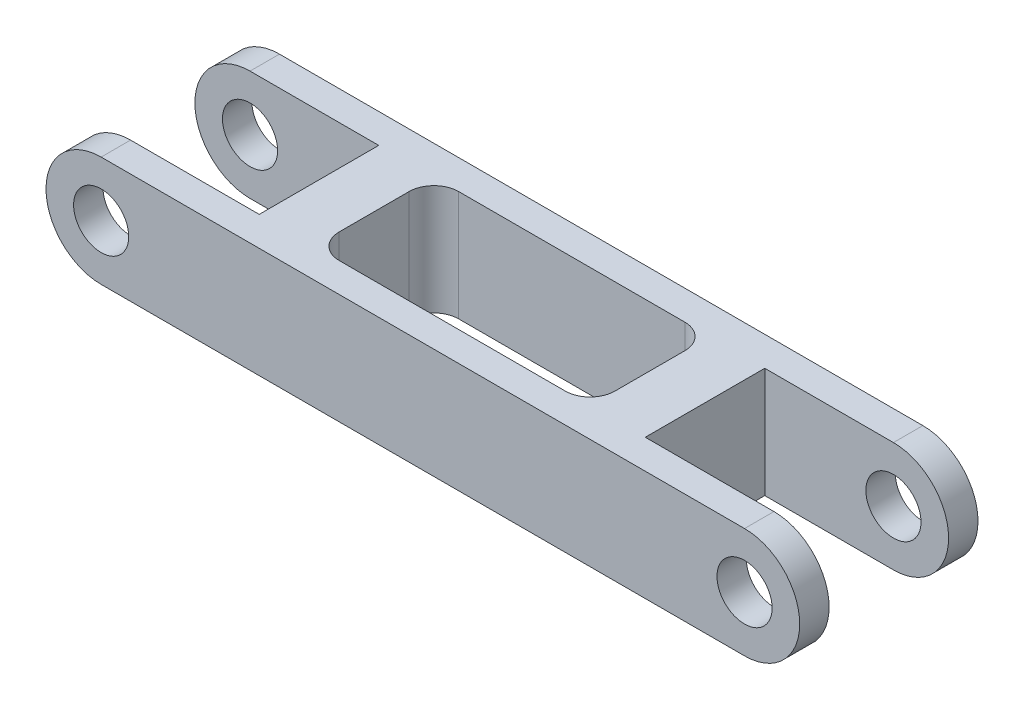
from build123d import *

# Parameters (mm, degrees)
SKETCH_1_R          = 3
EXTRUDE_1_DEPTH     = 19.4
SKETCH_2_W          = 20
SKETCH_2_H          = 13
CUT_EXTRUDE_1_DEPTH = 47.918653007


with BuildPart() as part:
    # 草图1 → 凸台-拉伸1 (new body)
    with BuildSketch(Plane.XY):
        with BuildLine():
            Line((-35, 6), (35, 6))
            ThreePointArc((35, 6), (41, 0), (35, -6))
            Line((35, -6), (-35, -6))
            ThreePointArc((-35, -6), (-41, 0), (-35, 6))
        make_face()
        with Locations((-35, 0)):
            Circle(SKETCH_1_R, mode=Mode.SUBTRACT)
        with Locations((35, 0)):
            Circle(SKETCH_1_R, mode=Mode.SUBTRACT)
    extrude(amount=EXTRUDE_1_DEPTH)

    # 草图2 → 切除-拉伸1 (cut, through all)
    with BuildSketch(Plane(origin=(0, 6, 0), x_dir=(1, 0, 0), z_dir=(0, 1, 0))):
        with Locations((-31, -9.7)):
            Rectangle(SKETCH_2_W, SKETCH_2_H)
        with Locations((31, -9.7)):
            Rectangle(SKETCH_2_W, SKETCH_2_H)
        with BuildLine():
            Line((-12.3, -3.2), (12.3, -3.2))
            ThreePointArc((12.3, -3.2), (14.209188309, -3.990811691), (15, -5.9))
            Line((15, -5.9), (15, -13.5))
            ThreePointArc((15, -13.5), (14.209188309, -15.409188309), (12.3, -16.2))
            Line((12.3, -16.2), (-12.3, -16.2))
            ThreePointArc((-12.3, -16.2), (-14.209188309, -15.409188309), (-15, -13.5))
            Line((-15, -13.5), (-15, -5.9))
            ThreePointArc((-15, -5.9), (-14.209188309, -3.990811691), (-12.3, -3.2))
        make_face()
    extrude(amount=-CUT_EXTRUDE_1_DEPTH, mode=Mode.SUBTRACT)


solid = part.part
